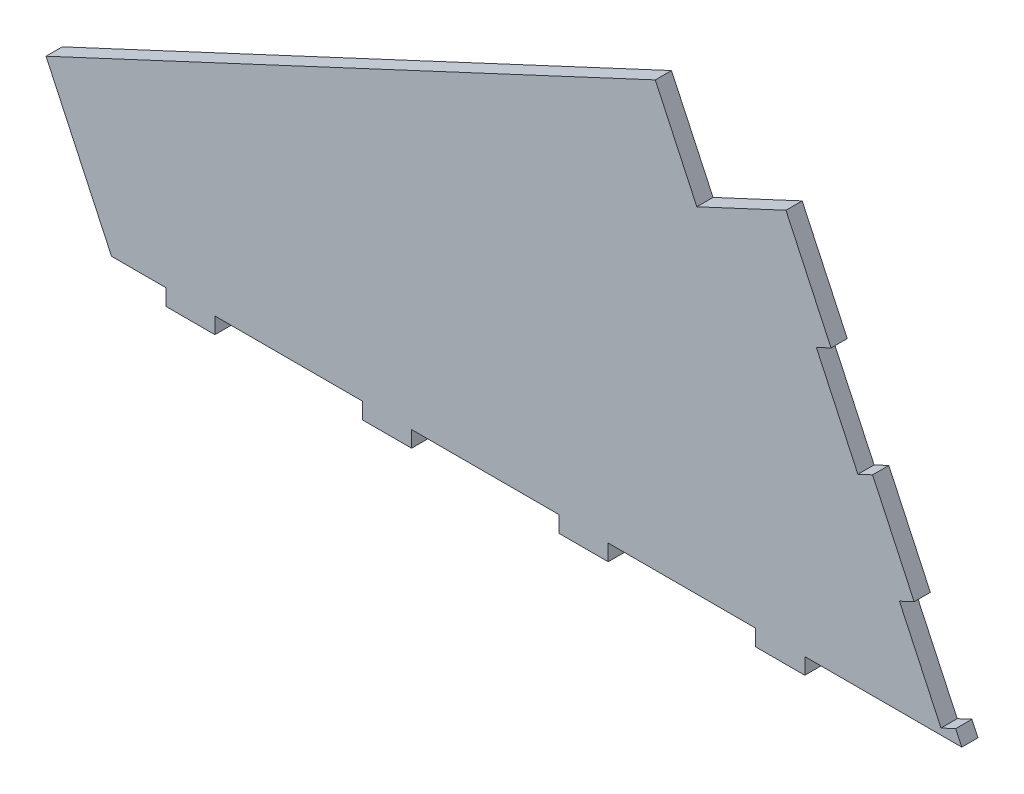
from build123d import *

# Parameters (mm, degrees)
BOSS_EXTRUDE1_DEPTH = 3.3
CUT_EXTRUDE1_DEPTH  = 3.3
SKETCH3_W           = 10
SKETCH3_H           = 3.717341371
SKETCH3_H_2         = 3.573770135
SKETCH3_H_3         = 3.710817969
SKETCH3_H_4         = 3.509523946
BOSS_EXTRUDE2_DEPTH = 3.3


with BuildPart() as part:
    # Sketch1 → Boss-Extrude1 (new body)
    with BuildSketch(Plane.XY):
        Polygon((321.546211231, 12.634626065), (148.585992231, 12.634626065), (135.256612252, 41.219573688), (259.198908878, 99.014815774), (267.651274112, 80.888660034), (285.777429853, 89.341025269), align=None)
    extrude(amount=-BOSS_EXTRUDE1_DEPTH)

    # Sketch2 → Cut-Extrude1 (cut)
    with BuildSketch(Plane.XY):
        Polygon((303.404032301, 51.540654333), (294.951667066, 69.666810074), (291.960851369, 68.27216981), (300.413216604, 50.14601407), align=None)
        Polygon((320.308762771, 15.288342852), (311.856397536, 33.414498593), (308.865581839, 32.019858329), (317.317947074, 13.893702588), align=None)
    extrude(amount=-CUT_EXTRUDE1_DEPTH, mode=Mode.SUBTRACT)

    # Sketch3 → Boss-Extrude2 (add)
    with BuildSketch(Plane.XY):
        with Locations((284.617848709, 11.193296751)):
            Rectangle(SKETCH3_W, SKETCH3_H)
        with Locations((244.617848709, 11.121511133)):
            Rectangle(SKETCH3_W, SKETCH3_H_2)
        with Locations((204.617848709, 11.19003505)):
            Rectangle(SKETCH3_W, SKETCH3_H_3)
        with Locations((164.617848709, 11.089388038)):
            Rectangle(SKETCH3_W, SKETCH3_H_4)
    extrude(amount=-BOSS_EXTRUDE2_DEPTH)


solid = part.part
